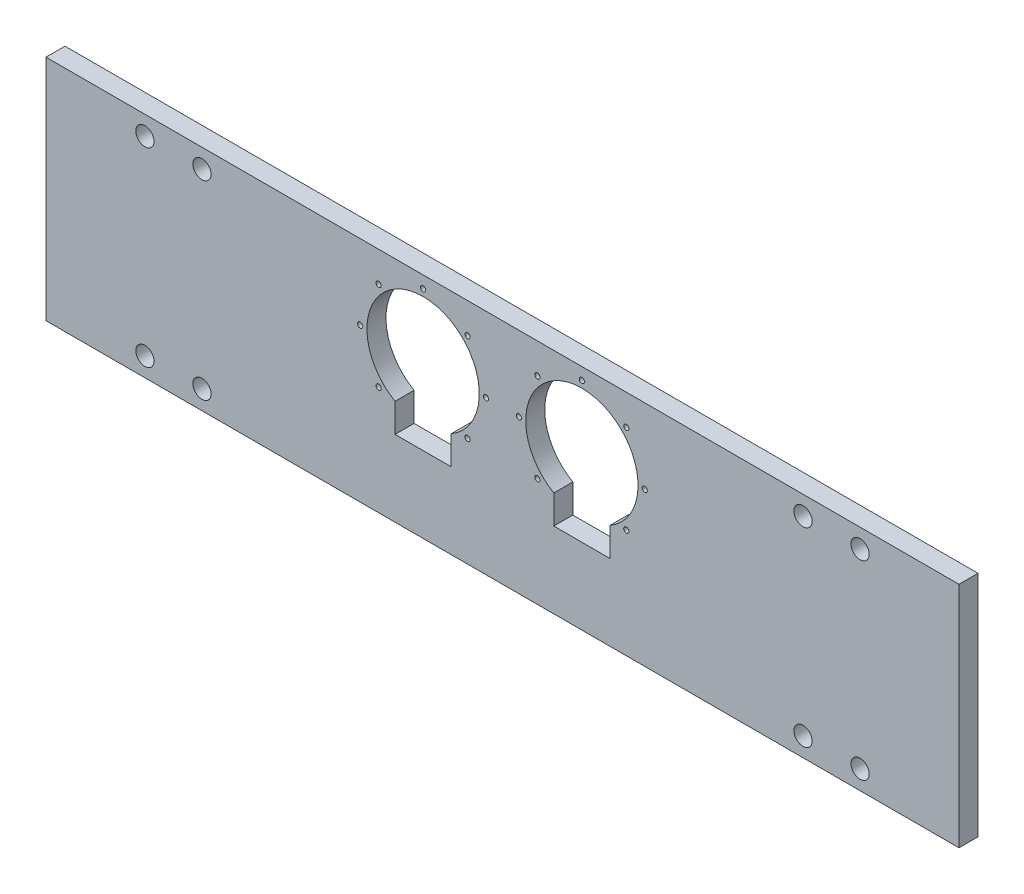
from build123d import *

# Parameters (mm, degrees)
SKETCH1_W           = 609.6
SKETCH1_H           = 152.4
SKETCH1_R           = 1.746
SKETCH1_R_2         = 6.096
BOSS_EXTRUDE1_DEPTH = 12.7


with BuildPart() as part:
    # Sketch1 → Boss-Extrude1 (new body)
    with BuildSketch(Plane.XY):
        Rectangle(SKETCH1_W, SKETCH1_H)
        with Locations((82.698486542, 55.898482492)):
            Circle(SKETCH1_R, mode=Mode.SUBTRACT)
        with Locations((95.00000245, 26.19999595)):
            Circle(SKETCH1_R, mode=Mode.SUBTRACT)
        with Locations((82.698486542, -3.498490592)):
            Circle(SKETCH1_R, mode=Mode.SUBTRACT)
        with Locations((23.301513458, -3.498490592)):
            Circle(SKETCH1_R, mode=Mode.SUBTRACT)
        with Locations((10.99999755, 26.19999595)):
            Circle(SKETCH1_R, mode=Mode.SUBTRACT)
        with Locations((23.301513458, 55.898482492)):
            Circle(SKETCH1_R, mode=Mode.SUBTRACT)
        with Locations((-53, 68.1999984)):
            Circle(SKETCH1_R, mode=Mode.SUBTRACT)
        with Locations((238.76, 63.5)):
            Circle(SKETCH1_R_2, mode=Mode.SUBTRACT)
        with Locations((200.66, 63.5)):
            Circle(SKETCH1_R_2, mode=Mode.SUBTRACT)
        with Locations((238.76, -63.5)):
            Circle(SKETCH1_R_2, mode=Mode.SUBTRACT)
        with Locations((200.66, -63.5)):
            Circle(SKETCH1_R_2, mode=Mode.SUBTRACT)
        with Locations((-82.698486542, -3.498490592)):
            Circle(SKETCH1_R, mode=Mode.SUBTRACT)
        with Locations((-95.00000245, 26.19999595)):
            Circle(SKETCH1_R, mode=Mode.SUBTRACT)
        with Locations((-82.698486542, 55.898482492)):
            Circle(SKETCH1_R, mode=Mode.SUBTRACT)
        with Locations((-23.301513458, 55.898482492)):
            Circle(SKETCH1_R, mode=Mode.SUBTRACT)
        with Locations((-10.99999755, 26.19999595)):
            Circle(SKETCH1_R, mode=Mode.SUBTRACT)
        with Locations((-23.301513458, -3.498490592)):
            Circle(SKETCH1_R, mode=Mode.SUBTRACT)
        with Locations((-238.76, 63.5)):
            Circle(SKETCH1_R_2, mode=Mode.SUBTRACT)
        with Locations((-200.66, 63.5)):
            Circle(SKETCH1_R_2, mode=Mode.SUBTRACT)
        with Locations((-200.66, -63.5)):
            Circle(SKETCH1_R_2, mode=Mode.SUBTRACT)
        with Locations((-238.76, -63.5)):
            Circle(SKETCH1_R_2, mode=Mode.SUBTRACT)
        with Locations((53, 68.1999984)):
            Circle(SKETCH1_R, mode=Mode.SUBTRACT)
        with BuildLine():
            Line((34.25, -6.275954242), (34.25, -25.4))
            Line((34.25, -25.4), (71.75, -25.4))
            Line((71.75, -25.4), (71.75, -6.275954242))
            ThreePointArc((71.75, -6.275954242), (53, 63.6999984), (34.25, -6.275954242))
        make_face(mode=Mode.SUBTRACT)
        with BuildLine():
            Line((-34.25, -6.275954242), (-34.25, -25.4))
            Line((-34.25, -25.4), (-71.75, -25.4))
            Line((-71.75, -25.4), (-71.75, -6.275954242))
            ThreePointArc((-71.75, -6.275954242), (-53, 63.6999984), (-34.25, -6.275954242))
        make_face(mode=Mode.SUBTRACT)
    extrude(amount=BOSS_EXTRUDE1_DEPTH)


solid = part.part
